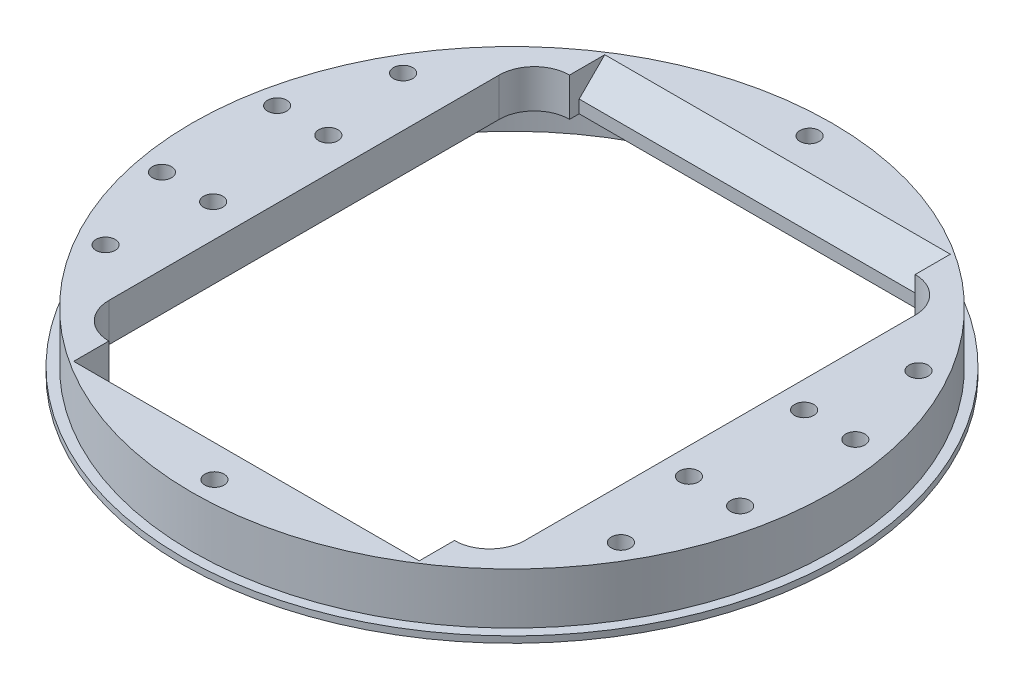
from build123d import *

# Parameters (mm, degrees)
SKETCH_1_R           = 51.5
SKETCH_1_R_2         = 25
EXTRUDE_1_DEPTH      = 9
CUT_EXTRUDE_START    = -8
SKETCH_12_R          = 51.5
SKETCH_12_R_2        = 50
CUT_EXTRUDE_11_DEPTH = 8
SKETCH_3_W           = 54
SKETCH_3_H           = 75
CUT_EXTRUDE_2_DEPTH  = 74.385965961
CHAMFER_1_SIZE       = 4
SKETCH_4_R           = 46.5
CUT_EXTRUDE_3_DEPTH  = 3
SKETCH_7_R           = 1.5
CUT_EXTRUDE_6_DEPTH  = 74.385965961
SKETCH_8_R           = 3
CUT_EXTRUDE_7_DEPTH  = 3
SKETCH_11_W          = 65
SKETCH_11_H          = 72
CUT_EXTRUDE_10_DEPTH = 74.385965961
FILLET_1_R           = 5.5
SKETCH_13_R          = 1.5
CUT_EXTRUDE_12_DEPTH = 20
SKETCH_14_R          = 3
CUT_EXTRUDE_13_DEPTH = 3


with BuildPart() as part:
    # 草图1 → 凸台-拉伸1 (new body)
    with BuildSketch(Plane(origin=(0, 0, 0), x_dir=(1, 0, 0), z_dir=(0, 1, 0))):
        with Locations(Location((0, 0, 0), (0, 0, 270))):
            Circle(SKETCH_1_R)
        with Locations(Location((0, 0, 0), (0, 0, 270))):
            Circle(SKETCH_1_R_2, mode=Mode.SUBTRACT)
    extrude(amount=EXTRUDE_1_DEPTH)

    # 草图12 → 切除-拉伸11 (cut)
    with BuildSketch(Plane(origin=(0, 9, 0), x_dir=(1, 0, 0), z_dir=(0, 1, 0)).offset(CUT_EXTRUDE_START)):
        with Locations(Location((0, 0, 0), (0, 0, 270))):
            Circle(SKETCH_12_R)
        with Locations(Location((0, 0, 0), (0, 0, 270))):
            Circle(SKETCH_12_R_2, mode=Mode.SUBTRACT)
    extrude(amount=CUT_EXTRUDE_11_DEPTH, mode=Mode.SUBTRACT)

    # 草图3 → 切除-拉伸2 (cut, through all)
    with BuildSketch(Plane(origin=(0, 9, 0), x_dir=(1, 0, 0), z_dir=(0, 1, 0))):
        Rectangle(SKETCH_3_W, SKETCH_3_H)
    extrude(amount=-CUT_EXTRUDE_2_DEPTH, mode=Mode.SUBTRACT)

    # 倒角1
    chamfer_1_edges = [part.edges().sort_by_distance(p)[0] for p in [
        (0, 9, -37.5),
        (0, 9, 37.5),
    ]]
    chamfer(chamfer_1_edges, length=CHAMFER_1_SIZE)

    # 草图4 → 切除-拉伸3 (cut)
    with BuildSketch(Plane.XZ):
        with Locations(Location((0, 0, 0), (0, 0, 270))):
            Circle(SKETCH_4_R)
    extrude(amount=-CUT_EXTRUDE_3_DEPTH, mode=Mode.SUBTRACT)

    # 草图7 → 切除-拉伸6 (cut, through all)
    with BuildSketch(Plane.XZ):
        with Locations(Location((0, 46.5, 0), (0, 0, 270))):
            Circle(SKETCH_7_R)
        with Locations(Location((40.270181276, 23.25, 0), (0, 0, 270))):
            Circle(SKETCH_7_R)
        with Locations(Location((40.270181276, -23.25, 0), (0, 0, 270))):
            Circle(SKETCH_7_R)
        with Locations(Location((0, -46.5, 0), (0, 0, 270))):
            Circle(SKETCH_7_R)
        with Locations(Location((-40.270181276, -23.25, 0), (0, 0, 270))):
            Circle(SKETCH_7_R)
        with Locations(Location((-40.270181276, 23.25, 0), (0, 0, 270))):
            Circle(SKETCH_7_R)
    extrude(amount=-CUT_EXTRUDE_6_DEPTH, mode=Mode.SUBTRACT)

    # 草图8 → 切除-拉伸7 (cut)
    with BuildSketch(Plane.XZ):
        with Locations((0, 46.5)):
            Circle(SKETCH_8_R)
        with Locations((40.270181276, 23.25)):
            Circle(SKETCH_8_R)
        with Locations((40.270181276, -23.25)):
            Circle(SKETCH_8_R)
        with Locations((0, -46.5)):
            Circle(SKETCH_8_R)
        with Locations((-40.270181276, -23.25)):
            Circle(SKETCH_8_R)
        with Locations((-40.270181276, 23.25)):
            Circle(SKETCH_8_R)
    extrude(amount=-CUT_EXTRUDE_7_DEPTH, mode=Mode.SUBTRACT)

    # 草图11 → 切除-拉伸10 (cut, through all)
    with BuildSketch(Plane(origin=(0, 9, 0), x_dir=(1, 0, 0), z_dir=(0, 1, 0))):
        Rectangle(SKETCH_11_W, SKETCH_11_H)
    extrude(amount=-CUT_EXTRUDE_10_DEPTH, mode=Mode.SUBTRACT)

    # 圆角1
    # the kernel refuses this fillet: 5.5 mm, written as the material it adds along each edge
    with BuildSketch(Plane(origin=(-32.5, 9, 36), x_dir=(1, 0, 0), z_dir=(0, -1, 0))) as fillet_1_piece_1_section:
        with BuildLine():
            CenterArc((FILLET_1_R, -FILLET_1_R), FILLET_1_R, 90, 90)
            Line((0, -FILLET_1_R), (0, 0))
            Line((0, 0), (FILLET_1_R, 0))
        make_face()
    fillet_1_piece_1 = extrude(amount=9, mode=Mode.PRIVATE)
    fillet_1_piece_1 = split(fillet_1_piece_1, bisect_by=Plane(origin=(-30.907548225, 3, 34.407548225), z_dir=(0, 1, 0)), keep=Keep.TOP, mode=Mode.PRIVATE)
    fillet_1_piece_1 = fillet_1_piece_1 & Plane(origin=(0, 6, 0), x_dir=(0, 0, -1), z_dir=(0, -1, 0)) * Cylinder(46.5, 40, mode=Mode.PRIVATE)
    add(fillet_1_piece_1)
    with BuildSketch(Plane(origin=(-32.5, 9, 36), x_dir=(1, 0, 0), z_dir=(0, -1, 0))) as fillet_1_piece_2_section:
        with BuildLine():
            CenterArc((FILLET_1_R, -FILLET_1_R), FILLET_1_R, 90, 90)
            Line((0, -FILLET_1_R), (0, 0))
            Line((0, 0), (FILLET_1_R, 0))
        make_face()
    fillet_1_piece_2 = extrude(amount=9, mode=Mode.PRIVATE)
    fillet_1_piece_2 = split(fillet_1_piece_2, bisect_by=Plane(origin=(-31.523516263, 3, 35.138738602), z_dir=(0, 1, 0)), keep=Keep.TOP, mode=Mode.PRIVATE)
    fillet_1_piece_2 = fillet_1_piece_2 - Plane(origin=(0, 6, 0), x_dir=(0, 0, -1), z_dir=(0, -1, 0)) * Cylinder(46.5, 40, mode=Mode.PRIVATE)
    add(fillet_1_piece_2)
    with BuildSketch(Plane(origin=(-32.5, 9, 36), x_dir=(1, 0, 0), z_dir=(0, -1, 0))) as fillet_1_piece_3_section:
        with BuildLine():
            CenterArc((FILLET_1_R, -FILLET_1_R), FILLET_1_R, 90, 90)
            Line((0, -FILLET_1_R), (0, 0))
            Line((0, 0), (FILLET_1_R, 0))
        make_face()
    fillet_1_piece_3 = extrude(amount=9, mode=Mode.PRIVATE)
    fillet_1_piece_3 = split(fillet_1_piece_3, bisect_by=Plane(origin=(-31.523516263, 3, 35.138738602), z_dir=(0, -1, 0)), keep=Keep.TOP, mode=Mode.PRIVATE)
    fillet_1_piece_3 = fillet_1_piece_3 - Plane(origin=(0, 1.5, 0), x_dir=(0, 0, -1), z_dir=(0, -1, 0)) * Cylinder(46.5, 40, mode=Mode.PRIVATE)
    add(fillet_1_piece_3)
    with BuildSketch(Plane(origin=(32.5, 9, 36), x_dir=(-1, 0, 0), z_dir=(0, -1, 0))) as fillet_1_piece_4_section:
        with BuildLine():
            CenterArc((FILLET_1_R, FILLET_1_R), FILLET_1_R, 180, 90)
            Line((0, FILLET_1_R), (0, 0))
            Line((0, 0), (FILLET_1_R, 0))
        make_face()
    fillet_1_piece_4 = extrude(amount=9, mode=Mode.PRIVATE)
    fillet_1_piece_4 = split(fillet_1_piece_4, bisect_by=Plane(origin=(30.907548225, 3, 34.407548225), z_dir=(0, 1, 0)), keep=Keep.TOP, mode=Mode.PRIVATE)
    fillet_1_piece_4 = fillet_1_piece_4 & Plane(origin=(0, 6, 0), x_dir=(0, 0, -1), z_dir=(0, -1, 0)) * Cylinder(46.5, 40, mode=Mode.PRIVATE)
    add(fillet_1_piece_4)
    with BuildSketch(Plane(origin=(32.5, 9, 36), x_dir=(-1, 0, 0), z_dir=(0, -1, 0))) as fillet_1_piece_5_section:
        with BuildLine():
            CenterArc((FILLET_1_R, FILLET_1_R), FILLET_1_R, 180, 90)
            Line((0, FILLET_1_R), (0, 0))
            Line((0, 0), (FILLET_1_R, 0))
        make_face()
    fillet_1_piece_5 = extrude(amount=9, mode=Mode.PRIVATE)
    fillet_1_piece_5 = split(fillet_1_piece_5, bisect_by=Plane(origin=(31.523516263, 3, 35.138738602), z_dir=(0, 1, 0)), keep=Keep.TOP, mode=Mode.PRIVATE)
    fillet_1_piece_5 = fillet_1_piece_5 - Plane(origin=(0, 6, 0), x_dir=(0, 0, -1), z_dir=(0, -1, 0)) * Cylinder(46.5, 40, mode=Mode.PRIVATE)
    add(fillet_1_piece_5)
    with BuildSketch(Plane(origin=(32.5, 9, 36), x_dir=(-1, 0, 0), z_dir=(0, -1, 0))) as fillet_1_piece_6_section:
        with BuildLine():
            CenterArc((FILLET_1_R, FILLET_1_R), FILLET_1_R, 180, 90)
            Line((0, FILLET_1_R), (0, 0))
            Line((0, 0), (FILLET_1_R, 0))
        make_face()
    fillet_1_piece_6 = extrude(amount=9, mode=Mode.PRIVATE)
    fillet_1_piece_6 = split(fillet_1_piece_6, bisect_by=Plane(origin=(31.523516263, 3, 35.138738602), z_dir=(0, -1, 0)), keep=Keep.TOP, mode=Mode.PRIVATE)
    fillet_1_piece_6 = fillet_1_piece_6 - Plane(origin=(0, 1.5, 0), x_dir=(0, 0, -1), z_dir=(0, -1, 0)) * Cylinder(46.5, 40, mode=Mode.PRIVATE)
    add(fillet_1_piece_6)
    with BuildSketch(Plane(origin=(32.5, 9, -36), x_dir=(0, 0, 1), z_dir=(0, -1, 0))) as fillet_1_piece_7_section:
        with BuildLine():
            CenterArc((FILLET_1_R, FILLET_1_R), FILLET_1_R, 180, 90)
            Line((0, FILLET_1_R), (0, 0))
            Line((0, 0), (FILLET_1_R, 0))
        make_face()
    fillet_1_piece_7 = extrude(amount=9, mode=Mode.PRIVATE)
    fillet_1_piece_7 = fillet_1_piece_7 & Plane(origin=(0, 6, 0), x_dir=(0, 0, -1), z_dir=(0, -1, 0)) * Cylinder(46.5, 40, mode=Mode.PRIVATE)
    fillet_1_piece_7 = split(fillet_1_piece_7, bisect_by=Plane(origin=(30.907548225, 3, -34.407548225), z_dir=(0, 1, 0)), keep=Keep.TOP, mode=Mode.PRIVATE)
    add(fillet_1_piece_7)
    with BuildSketch(Plane(origin=(32.5, 9, -36), x_dir=(0, 0, 1), z_dir=(0, -1, 0))) as fillet_1_piece_8_section:
        with BuildLine():
            CenterArc((FILLET_1_R, FILLET_1_R), FILLET_1_R, 180, 90)
            Line((0, FILLET_1_R), (0, 0))
            Line((0, 0), (FILLET_1_R, 0))
        make_face()
    fillet_1_piece_8 = extrude(amount=9, mode=Mode.PRIVATE)
    fillet_1_piece_8 = fillet_1_piece_8 - Plane(origin=(0, 6, 0), x_dir=(0, 0, -1), z_dir=(0, -1, 0)) * Cylinder(46.5, 40, mode=Mode.PRIVATE)
    fillet_1_piece_8 = split(fillet_1_piece_8, bisect_by=Plane(origin=(31.523516263, 3, -35.138738602), z_dir=(0, 1, 0)), keep=Keep.TOP, mode=Mode.PRIVATE)
    add(fillet_1_piece_8)
    with BuildSketch(Plane(origin=(32.5, 9, -36), x_dir=(0, 0, 1), z_dir=(0, -1, 0))) as fillet_1_piece_9_section:
        with BuildLine():
            CenterArc((FILLET_1_R, FILLET_1_R), FILLET_1_R, 180, 90)
            Line((0, FILLET_1_R), (0, 0))
            Line((0, 0), (FILLET_1_R, 0))
        make_face()
    fillet_1_piece_9 = extrude(amount=9, mode=Mode.PRIVATE)
    fillet_1_piece_9 = fillet_1_piece_9 - Plane(origin=(0, 1.5, 0), x_dir=(0, 0, -1), z_dir=(0, -1, 0)) * Cylinder(46.5, 40, mode=Mode.PRIVATE)
    fillet_1_piece_9 = split(fillet_1_piece_9, bisect_by=Plane(origin=(31.523516263, 3, -35.138738602), z_dir=(0, -1, 0)), keep=Keep.TOP, mode=Mode.PRIVATE)
    add(fillet_1_piece_9)
    with BuildSketch(Plane(origin=(-32.5, 9, -36), x_dir=(1, 0, 0), z_dir=(0, -1, 0))) as fillet_1_piece_10_section:
        with BuildLine():
            CenterArc((FILLET_1_R, FILLET_1_R), FILLET_1_R, 180, 90)
            Line((0, FILLET_1_R), (0, 0))
            Line((0, 0), (FILLET_1_R, 0))
        make_face()
    fillet_1_piece_10 = extrude(amount=9, mode=Mode.PRIVATE)
    fillet_1_piece_10 = fillet_1_piece_10 & Plane(origin=(0, 6, 0), x_dir=(0, 0, -1), z_dir=(0, -1, 0)) * Cylinder(46.5, 40, mode=Mode.PRIVATE)
    fillet_1_piece_10 = split(fillet_1_piece_10, bisect_by=Plane(origin=(-30.907548225, 3, -34.407548225), z_dir=(0, 1, 0)), keep=Keep.TOP, mode=Mode.PRIVATE)
    add(fillet_1_piece_10)
    with BuildSketch(Plane(origin=(-32.5, 9, -36), x_dir=(1, 0, 0), z_dir=(0, -1, 0))) as fillet_1_piece_11_section:
        with BuildLine():
            CenterArc((FILLET_1_R, FILLET_1_R), FILLET_1_R, 180, 90)
            Line((0, FILLET_1_R), (0, 0))
            Line((0, 0), (FILLET_1_R, 0))
        make_face()
    fillet_1_piece_11 = extrude(amount=9, mode=Mode.PRIVATE)
    fillet_1_piece_11 = fillet_1_piece_11 - Plane(origin=(0, 6, 0), x_dir=(0, 0, -1), z_dir=(0, -1, 0)) * Cylinder(46.5, 40, mode=Mode.PRIVATE)
    fillet_1_piece_11 = split(fillet_1_piece_11, bisect_by=Plane(origin=(-31.523516263, 3, -35.138738602), z_dir=(0, 1, 0)), keep=Keep.TOP, mode=Mode.PRIVATE)
    add(fillet_1_piece_11)
    with BuildSketch(Plane(origin=(-32.5, 9, -36), x_dir=(1, 0, 0), z_dir=(0, -1, 0))) as fillet_1_piece_12_section:
        with BuildLine():
            CenterArc((FILLET_1_R, FILLET_1_R), FILLET_1_R, 180, 90)
            Line((0, FILLET_1_R), (0, 0))
            Line((0, 0), (FILLET_1_R, 0))
        make_face()
    fillet_1_piece_12 = extrude(amount=9, mode=Mode.PRIVATE)
    fillet_1_piece_12 = fillet_1_piece_12 - Plane(origin=(0, 1.5, 0), x_dir=(0, 0, -1), z_dir=(0, -1, 0)) * Cylinder(46.5, 40, mode=Mode.PRIVATE)
    fillet_1_piece_12 = split(fillet_1_piece_12, bisect_by=Plane(origin=(-31.523516263, 3, -35.138738602), z_dir=(0, -1, 0)), keep=Keep.TOP, mode=Mode.PRIVATE)
    add(fillet_1_piece_12)

    # 草图13 → 切除-拉伸12 (cut)
    with BuildSketch(Plane(origin=(90.573916545, 17, 197.95666402), x_dir=(0.9918515590673906, 0, 0.1273989198368124), z_dir=(0, 1, 0))):
        with Locations(Location((-161.529552035, 187.909140098, 0), (0, 0, 277.319311568))):
            Circle(SKETCH_13_R)
        with Locations(Location((-153.594739562, 188.928331456, 0), (0, 0, 277.319311568))):
            Circle(SKETCH_13_R)
        with Locations(Location((-159.236371478, 170.055812034, 0), (0, 0, 277.319311568))):
            Circle(SKETCH_13_R)
        with Locations(Location((-151.301559005, 171.075003393, 0), (0, 0, 277.319311568))):
            Circle(SKETCH_13_R)
        with Locations(Location((-79.850576146, 198.400441146, 0), (0, 0, 277.319311568))):
            Circle(SKETCH_13_R)
        with Locations(Location((-71.915763673, 199.419632505, 0), (0, 0, 277.319311568))):
            Circle(SKETCH_13_R)
        with Locations(Location((-77.557395589, 180.547113083, 0), (0, 0, 277.319311568))):
            Circle(SKETCH_13_R)
        with Locations(Location((-69.622583116, 181.566304442, 0), (0, 0, 277.319311568))):
            Circle(SKETCH_13_R)
    extrude(amount=-CUT_EXTRUDE_12_DEPTH, mode=Mode.SUBTRACT)

    # 草图14 → 切除-拉伸13 (cut)
    with BuildSketch(Plane.XZ):
        with Locations((-45.7, 9)):
            Circle(SKETCH_14_R)
        with Locations((44.65, 9)):
            Circle(SKETCH_14_R)
        with Locations((-45.7, -9)):
            Circle(SKETCH_14_R)
        with Locations((44.65, -9)):
            Circle(SKETCH_14_R)
    extrude(amount=-CUT_EXTRUDE_13_DEPTH, mode=Mode.SUBTRACT)


solid = part.part
